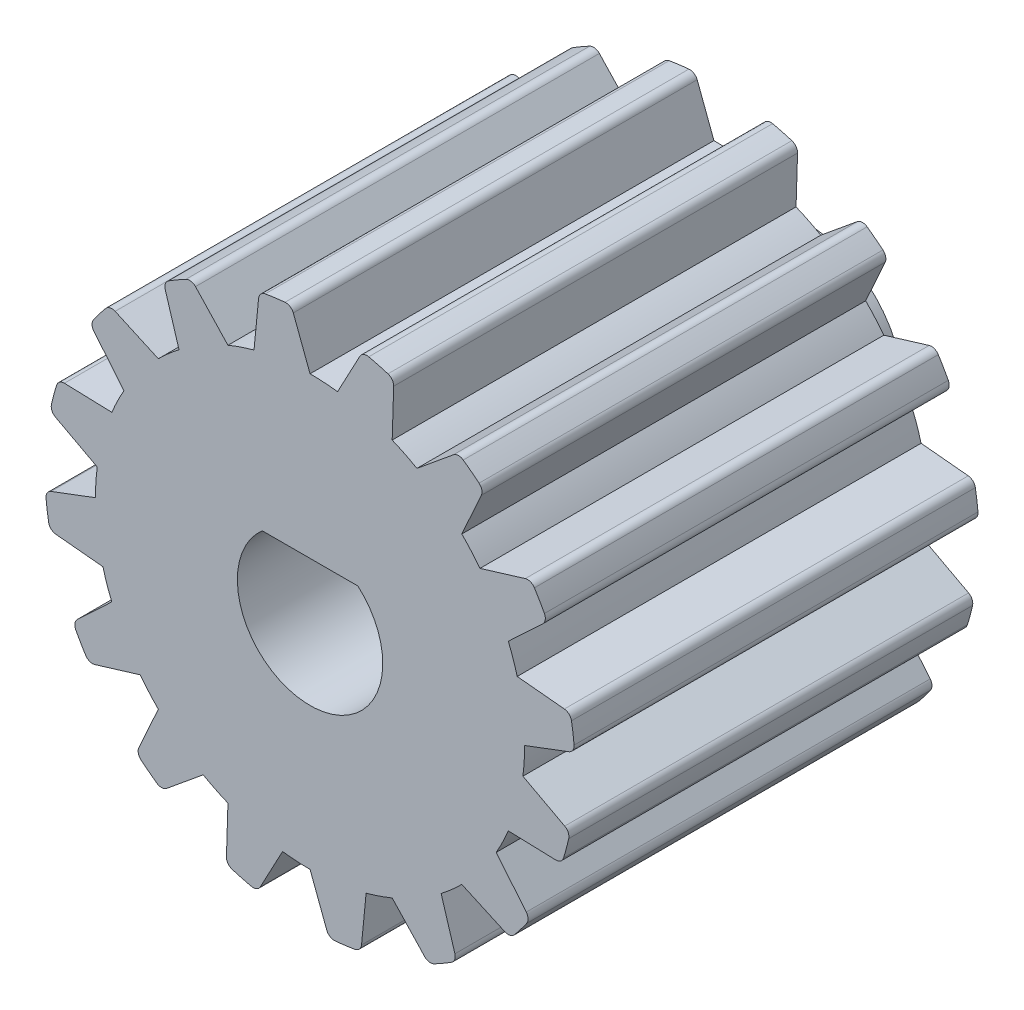
from build123d import *

# Parameters (mm, degrees)
SALIENTE_EXTRUIR1_DEPTH    = 15
CROQUIS5_R                 = 4.5
SALIENTE_EXTRUIR2_DEPTH    = 6
CORTAR_EXTRUIR1_DEPTH      = 26.166810333
ESCALA1_SCALE              = 1.5
CORTAR_EXTRUIR2_DEPTH      = 38.7502155
CORTAR_EXTRUIR2_DEPTH_BACK = 38.7502155
CORTAR_EXTRUIR3_DEPTH      = 38.7502155
CORTAR_EXTRUIR3_DEPTH_BACK = 5.8
CROQUIS7_R                 = 10
SALIENTE_EXTRUIR3_START    = 1.87
CROQUIS8_R                 = 5.5
SALIENTE_EXTRUIR3_DEPTH    = 1.87


with BuildPart() as part:
    # Croquis2 → Saliente-Extruir1 (new body)
    with BuildSketch(Plane.XY):
        with BuildLine():
            Line((-2.081696937, 7.693567449), (-1.911179214, 9.445287663))
            ThreePointArc((-1.911179214, 9.445287663), (-1.831468139, 9.618345927), (-1.663611198, 9.708496165))
            ThreePointArc((-1.663611198, 9.708496165), (-1.297642615, 9.764149919), (-0.929841298, 9.806013214))
            ThreePointArc((-0.929841298, 9.806013214), (-0.744265019, 9.762833784), (-0.622120698, 9.616601835))
            Line((-0.622120698, 9.616601835), (0, 7.97022222))
            ThreePointArc((0, 7.97022222), (0.511536449, 7.953789832), (1.020963606, 7.904560428))
            Line((1.020963606, 7.904560428), (1.848855744, 9.457684572))
            ThreePointArc((1.848855744, 9.457684572), (1.988725705, 9.587065453), (2.1783043, 9.606117341))
            ThreePointArc((2.1783043, 9.606117341), (2.537712953, 9.517484592), (2.893537451, 9.415409764))
            ThreePointArc((2.893537451, 9.415409764), (3.048463524, 9.304500205), (3.105349619, 9.122656892))
            Line((3.105349619, 9.122656892), (3.050071996, 7.363525179))
            ThreePointArc((3.050071996, 7.363525179), (3.516381649, 7.152587108), (3.968191694, 6.912155736))
            Line((3.968191694, 6.912155736), (5.327419174, 8.030234739))
            ThreePointArc((5.327419174, 8.030234739), (5.506154088, 8.09624117), (5.688592714, 8.041294232))
            ThreePointArc((5.688592714, 8.041294232), (5.986724728, 7.821868513), (6.276401353, 7.591395527))
            ThreePointArc((6.276401353, 7.591395527), (6.37709113, 7.429640815), (6.360058606, 7.239870134))
            Line((6.360058606, 7.239870134), (5.635798179, 5.635798179))
            ThreePointArc((5.635798179, 5.635798179), (5.985889619, 5.262467835), (6.311298569, 4.867437992))
            Line((6.311298569, 4.867437992), (7.994931329, 5.380254461))
            ThreePointArc((7.994931329, 5.380254461), (8.185320425, 5.372837562), (8.332844455, 5.252256971))
            ThreePointArc((8.332844455, 5.252256971), (8.524311933, 4.935443857), (8.703740045, 4.611660138))
            ThreePointArc((8.703740045, 4.611660138), (8.73486442, 4.42368596), (8.646506324, 4.254878777))
            Line((8.646506324, 4.254878777), (7.363525179, 3.050071996))
            ThreePointArc((7.363525179, 3.050071996), (7.544100156, 2.571185538), (7.693567449, 2.081696937))
            Line((7.693567449, 2.081696937), (9.445287663, 1.911179214))
            ThreePointArc((9.445287663, 1.911179214), (9.618345927, 1.831468139), (9.708496165, 1.663611198))
            ThreePointArc((9.708496165, 1.663611198), (9.764149919, 1.297642615), (9.806013214, 0.929841298))
            ThreePointArc((9.806013214, 0.929841298), (9.762833784, 0.744265019), (9.616601835, 0.622120698))
            Line((9.616601835, 0.622120698), (7.97022222, 0))
            ThreePointArc((7.97022222, 0), (7.953789832, -0.511536449), (7.904560428, -1.020963606))
            Line((7.904560428, -1.020963606), (9.457684572, -1.848855744))
            ThreePointArc((9.457684572, -1.848855744), (9.587065453, -1.988725705), (9.606117341, -2.1783043))
            ThreePointArc((9.606117341, -2.1783043), (9.517484592, -2.537712953), (9.415409764, -2.893537451))
            ThreePointArc((9.415409764, -2.893537451), (9.304500205, -3.048463524), (9.122656892, -3.105349619))
            Line((9.122656892, -3.105349619), (7.363525179, -3.050071996))
            ThreePointArc((7.363525179, -3.050071996), (7.152587108, -3.516381649), (6.912155736, -3.968191694))
            Line((6.912155736, -3.968191694), (8.030234739, -5.327419174))
            ThreePointArc((8.030234739, -5.327419174), (8.09624117, -5.506154088), (8.041294232, -5.688592714))
            ThreePointArc((8.041294232, -5.688592714), (7.821868513, -5.986724728), (7.591395527, -6.276401353))
            ThreePointArc((7.591395527, -6.276401353), (7.429640815, -6.37709113), (7.239870134, -6.360058606))
            Line((7.239870134, -6.360058606), (5.635798179, -5.635798179))
            ThreePointArc((5.635798179, -5.635798179), (5.262467835, -5.985889619), (4.867437992, -6.311298569))
            Line((4.867437992, -6.311298569), (5.380254461, -7.994931329))
            ThreePointArc((5.380254461, -7.994931329), (5.372837562, -8.185320425), (5.252256971, -8.332844455))
            ThreePointArc((5.252256971, -8.332844455), (4.935443857, -8.524311933), (4.611660138, -8.703740045))
            ThreePointArc((4.611660138, -8.703740045), (4.42368596, -8.73486442), (4.254878777, -8.646506324))
            Line((4.254878777, -8.646506324), (3.050071996, -7.363525179))
            ThreePointArc((3.050071996, -7.363525179), (2.571185538, -7.544100156), (2.081696937, -7.693567449))
            Line((2.081696937, -7.693567449), (1.911179214, -9.445287663))
            ThreePointArc((1.911179214, -9.445287663), (1.831468139, -9.618345927), (1.663611198, -9.708496165))
            ThreePointArc((1.663611198, -9.708496165), (1.297642615, -9.764149919), (0.929841298, -9.806013214))
            ThreePointArc((0.929841298, -9.806013214), (0.744265019, -9.762833784), (0.622120698, -9.616601835))
            Line((0.622120698, -9.616601835), (0, -7.97022222))
            ThreePointArc((0, -7.97022222), (-0.511536449, -7.953789832), (-1.020963606, -7.904560428))
            Line((-1.020963606, -7.904560428), (-1.848855744, -9.457684572))
            ThreePointArc((-1.848855744, -9.457684572), (-1.988725705, -9.587065453), (-2.1783043, -9.606117341))
            ThreePointArc((-2.1783043, -9.606117341), (-2.537712953, -9.517484592), (-2.893537451, -9.415409764))
            ThreePointArc((-2.893537451, -9.415409764), (-3.048463524, -9.304500205), (-3.105349619, -9.122656892))
            Line((-3.105349619, -9.122656892), (-3.050071996, -7.363525179))
            ThreePointArc((-3.050071996, -7.363525179), (-3.516381649, -7.152587108), (-3.968191694, -6.912155736))
            Line((-3.968191694, -6.912155736), (-5.327419174, -8.030234739))
            ThreePointArc((-5.327419174, -8.030234739), (-5.506154088, -8.09624117), (-5.688592714, -8.041294232))
            ThreePointArc((-5.688592714, -8.041294232), (-5.986724728, -7.821868513), (-6.276401353, -7.591395527))
            ThreePointArc((-6.276401353, -7.591395527), (-6.37709113, -7.429640815), (-6.360058606, -7.239870134))
            Line((-6.360058606, -7.239870134), (-5.635798179, -5.635798179))
            ThreePointArc((-5.635798179, -5.635798179), (-5.985889619, -5.262467835), (-6.311298569, -4.867437992))
            Line((-6.311298569, -4.867437992), (-7.994931329, -5.380254461))
            ThreePointArc((-7.994931329, -5.380254461), (-8.185320425, -5.372837562), (-8.332844455, -5.252256971))
            ThreePointArc((-8.332844455, -5.252256971), (-8.524311933, -4.935443857), (-8.703740045, -4.611660138))
            ThreePointArc((-8.703740045, -4.611660138), (-8.73486442, -4.42368596), (-8.646506324, -4.254878777))
            Line((-8.646506324, -4.254878777), (-7.363525179, -3.050071996))
            ThreePointArc((-7.363525179, -3.050071996), (-7.544100156, -2.571185538), (-7.693567449, -2.081696937))
            Line((-7.693567449, -2.081696937), (-9.445287663, -1.911179214))
            ThreePointArc((-9.445287663, -1.911179214), (-9.618345927, -1.831468139), (-9.708496165, -1.663611198))
            ThreePointArc((-9.708496165, -1.663611198), (-9.764149919, -1.297642615), (-9.806013214, -0.929841298))
            ThreePointArc((-9.806013214, -0.929841298), (-9.762833784, -0.744265019), (-9.616601835, -0.622120698))
            Line((-9.616601835, -0.622120698), (-7.97022222, 0))
            ThreePointArc((-7.97022222, 0), (-7.953789832, 0.511536449), (-7.904560428, 1.020963606))
            Line((-7.904560428, 1.020963606), (-9.457684572, 1.848855744))
            ThreePointArc((-9.457684572, 1.848855744), (-9.587065453, 1.988725705), (-9.606117341, 2.1783043))
            ThreePointArc((-9.606117341, 2.1783043), (-9.517484592, 2.537712953), (-9.415409764, 2.893537451))
            ThreePointArc((-9.415409764, 2.893537451), (-9.304500205, 3.048463524), (-9.122656892, 3.105349619))
            Line((-9.122656892, 3.105349619), (-7.363525179, 3.050071996))
            ThreePointArc((-7.363525179, 3.050071996), (-7.152587108, 3.516381649), (-6.912155736, 3.968191694))
            Line((-6.912155736, 3.968191694), (-8.030234739, 5.327419174))
            ThreePointArc((-8.030234739, 5.327419174), (-8.09624117, 5.506154088), (-8.041294232, 5.688592714))
            ThreePointArc((-8.041294232, 5.688592714), (-7.821868513, 5.986724728), (-7.591395527, 6.276401353))
            ThreePointArc((-7.591395527, 6.276401353), (-7.429640815, 6.37709113), (-7.239870134, 6.360058606))
            Line((-7.239870134, 6.360058606), (-5.635798179, 5.635798179))
            ThreePointArc((-5.635798179, 5.635798179), (-5.262467835, 5.985889619), (-4.867437992, 6.311298569))
            Line((-4.867437992, 6.311298569), (-5.380254461, 7.994931329))
            ThreePointArc((-5.380254461, 7.994931329), (-5.372837562, 8.185320425), (-5.252256971, 8.332844455))
            ThreePointArc((-5.252256971, 8.332844455), (-4.935443857, 8.524311933), (-4.611660138, 8.703740045))
            ThreePointArc((-4.611660138, 8.703740045), (-4.42368596, 8.73486442), (-4.254878777, 8.646506324))
            Line((-4.254878777, 8.646506324), (-3.050071996, 7.363525179))
            ThreePointArc((-3.050071996, 7.363525179), (-2.571185538, 7.544100156), (-2.081696937, 7.693567449))
        make_face()
    extrude(amount=SALIENTE_EXTRUIR1_DEPTH)

    # Croquis5 → Saliente-Extruir2 (add)
    with BuildSketch(Plane(origin=(0, 0, 0), x_dir=(-1, 0, 0), z_dir=(0, 0, -1))):
        Circle(CROQUIS5_R)
    extrude(amount=SALIENTE_EXTRUIR2_DEPTH)

    # Croquis3 → Cortar-Extruir1 (cut, through all)
    with BuildSketch(Plane.XY.offset(15)):
        with BuildLine():
            Line((-1.496696362, 1.68), (1.496696362, 1.68))
            ThreePointArc((1.496696362, 1.68), (0, -2.25), (-1.496696362, 1.68))
        make_face()
    extrude(amount=-CORTAR_EXTRUIR1_DEPTH, mode=Mode.SUBTRACT)


with BuildPart() as part_1:
    # Escala1: scaled about (0, 0, 0)
    add(part.part.scale(ESCALA1_SCALE))

    # Croquis6 → Cortar-Extruir2 (cut, two sides: drawn at the far end of the back side and taken through both)
    with BuildSketch(Plane.XY.offset(22.5).offset(-CORTAR_EXTRUIR2_DEPTH_BACK)):
        with BuildLine():
            Line((2.664582519, 3.05), (-2.664582519, 3.05))
            ThreePointArc((-2.664582519, 3.05), (0, -4.05), (2.664582519, 3.05))
        make_face()
    extrude(amount=CORTAR_EXTRUIR2_DEPTH + CORTAR_EXTRUIR2_DEPTH_BACK, mode=Mode.SUBTRACT)

    # Croquis7 → Cortar-Extruir3 (cut, two sides: drawn at the far end of the back side and taken through both)
    with BuildSketch(Plane(origin=(0, 0, -9), x_dir=(-1, 0, 0), z_dir=(0, 0, -1)).offset(-CORTAR_EXTRUIR3_DEPTH_BACK)):
        Circle(CROQUIS7_R)
    extrude(amount=CORTAR_EXTRUIR3_DEPTH + CORTAR_EXTRUIR3_DEPTH_BACK, mode=Mode.SUBTRACT)

    # Croquis8 → Saliente-Extruir3 (add)
    with BuildSketch(Plane(origin=(0, 0, -3.2), x_dir=(-1, 0, 0), z_dir=(0, 0, -1)).offset(SALIENTE_EXTRUIR3_START)):
        Circle(CROQUIS8_R)
        with BuildLine():
            Line((-2.664582519, 3.05), (2.664582519, 3.05))
            ThreePointArc((2.664582519, 3.05), (0, -4.05), (-2.664582519, 3.05))
        make_face(mode=Mode.SUBTRACT)
    extrude(amount=-SALIENTE_EXTRUIR3_DEPTH)


solid = part_1.part
